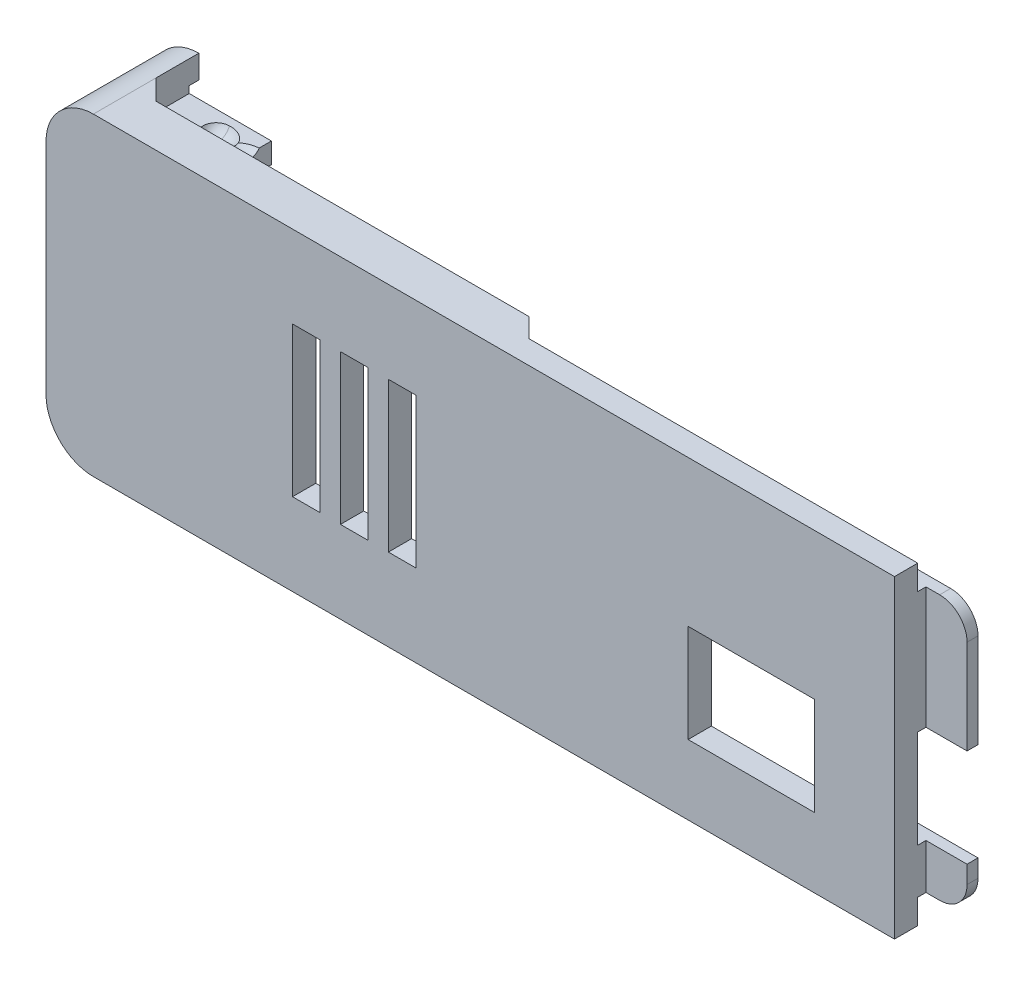
from build123d import *

# Parameters (mm, degrees)
BOSS_EXTRUDE2_DEPTH       = 7.7
BOSS_EXTRUDE3_DEPTH       = 58.493998982
BOSS_EXTRUDE4_REACH       = 69.972
SKETCH7_W                 = 6
SKETCH7_H                 = 7
BOSS_EXTRUDE5_DEPTH       = 1.9
SKETCH9_W                 = 5
SKETCH9_H                 = 0.4
CUT_EXTRUDE1_DEPTH        = 6
SKETCH10_W                = 51.633694728
SKETCH10_H                = 3.1
BOSS_EXTRUDE6_DEPTH       = 1
MIRROR1_START             = 27.403764687
MIRROR1_DEPTH             = 2.800044537
MIRROR1_START_2           = 29.203809224
MIRROR1_2_DEPTH           = 1
MIRROR1_START_3           = 30.203809224
MIRROR1_3_OUTLINE_W       = 6
MIRROR1_3_OUTLINE_H       = 7
MIRROR1_3_DEPTH           = 0.9
MIRROR1_4_OUTLINE_W       = 0.860304254
MIRROR1_4_OUTLINE_H       = 3.1
MIRROR1_4_DEPTH           = 1.800044537
MIRROR1_START_4           = 5.029168405
MIRROR1_5_OUTLINE_W       = 1
MIRROR1_5_OUTLINE_H       = 3.9
MIRROR1_5_DEPTH           = 6
BOSS_EXTRUDE7_START       = -1.7
BOSS_EXTRUDE7_DEPTH       = 1.7
BOSS_EXTRUDE12_DEPTH      = 3
BOSS_EXTRUDE12_DEPTH_BACK = 1.7
SKETCH14_W                = 1.4
SKETCH14_H                = 19.327817751
FILLET1_R                 = 2
CUT_EXTRUDE2_DEPTH        = 0.6
CUT_EXTRUDE3_DEPTH        = 1.7
SKETCH18_W                = 2
SKETCH18_H                = 2.1
BOSS_EXTRUDE13_DEPTH      = 5.3
SKETCH19_W                = 9.243692919
SKETCH19_H                = 7.158225614
CUT_EXTRUDE4_DEPTH        = 1.7
SKETCH20_W                = 4.7
SKETCH20_H                = 7.158225614
CUT_EXTRUDE5_DEPTH        = 1.4
SKETCH21_W                = 2
SKETCH21_H                = 10.927906825
CUT_EXTRUDE6_DEPTH        = 84.772901086


with BuildPart() as part:
    # Sketch1 → Boss-Extrude2 (new body)
    with BuildSketch(Plane.XY):
        with BuildLine():
            Line((1.569168405, 30.881718108), (1.569168405, 46.853718091))
            ThreePointArc((1.569168405, 46.853718091), (2.581495272, 49.306663259), (5.029168405, 50.331671512))
            Line((5.029168405, 50.331671512), (5.029168405, 48.631626975))
            ThreePointArc((5.029168405, 48.631626975), (3.783584613, 48.104573798), (3.269168405, 46.853718091))
            Line((3.269168405, 46.853718091), (3.269168405, 30.881718108))
            ThreePointArc((3.269168405, 30.881718108), (3.783584613, 29.630862401), (5.029168405, 29.103809224))
            Line((5.029168405, 29.103809224), (5.029168405, 27.403764687))
            ThreePointArc((5.029168405, 27.403764687), (2.581495272, 28.428772939), (1.569168405, 30.881718108))
        make_face()
    extrude(amount=BOSS_EXTRUDE2_DEPTH)

    # Sketch3 → Boss-Extrude3 (add)
    with BuildSketch(Plane(origin=(5.029168405, 0, 0), x_dir=(0, 0, -1), z_dir=(1, 0, 0))):
        Polygon((-7.7, 48.631626975), (-7.7, 50.331671512), (-6.1, 50.331671512), (-6.1, 48.631626975), (-6.1, 48.531626975), (-7.7, 48.531626975), align=None)
    extrude(amount=BOSS_EXTRUDE3_DEPTH)

    # Boss-Extrude4: up to this face of the body (flat: up to its plane)
    boss_extrude4_end = Plane(part.part.faces().sort_by_distance((34.276167896, 48.531626975, 6.9))[0])
    # Sketch4 → Boss-Extrude4 (add, up to the picked face)
    with BuildSketch(Plane(origin=(0, 50.331671512, 0), x_dir=(1, 0, 0), z_dir=(0, 1, 0)), mode=Mode.PRIVATE) as boss_extrude4_sk1:
        Polygon((35.231704884, -6.1), (5.029168405, -6.1), (5.029168405, -3.123421356), (6.505747049, -4.6), (33.731704884, -4.6), (35.202415562, -6.070710678), align=None)
    boss_extrude4_tool1 = split(extrude(boss_extrude4_sk1.sketch, amount=-BOSS_EXTRUDE4_REACH, mode=Mode.PRIVATE), bisect_by=boss_extrude4_end, keep=Keep.BOTH, mode=Mode.PRIVATE)
    add(boss_extrude4_tool1.solids().sort_by(Axis((19.415766, 50.331672, 5.326299), (0, -1, 0)))[0])

    # Sketch7 → Boss-Extrude5 (add)
    with BuildSketch(Plane.XZ.offset(-48.531626975)):
        with Locations((8.029168405, 4.2)):
            Rectangle(SKETCH7_W, SKETCH7_H)
    extrude(amount=BOSS_EXTRUDE5_DEPTH)

    # Sketch8 → Cut-Revolve1 (revolve, cut)
    with BuildSketch(Plane(origin=(0, 48.531626975, 0), x_dir=(1, 0, 0), z_dir=(0, 1, 0))):
        with BuildLine():
            Line((7.493162671, -2.25), (9.593162671, -2.25))
            Line((9.593162671, -2.25), (11.029168405, -2.25))
            Line((11.029168405, -2.25), (11.029168405, -3.013237094))
            add(Edge.make_bspline(
                [(11.029168405, -3.013237094), (10.455622255, -2.979221008), (9.952164105, -2.7)],
                knots=[0, 0, 0, 1, 1, 1], degree=2))
            add(Edge.make_bspline(
                [(8.543162671, -3.3), (9.366293549, -3.339525323), (9.952164105, -2.7)],
                knots=[0, 0, 0, 1, 1, 1], degree=2))
            ThreePointArc((8.543162671, -3.3), (7.800700551, -2.99246212), (7.493162671, -2.25))
        make_face()
    revolve(axis=Axis((7.493162671, 48.531626975, 2.25), (1, 0, 0)), mode=Mode.SUBTRACT)

    # Sketch9 → Cut-Extrude1 (cut)
    with BuildSketch(Plane(origin=(11.029168405, 0, 0), x_dir=(0, 0, -1), z_dir=(1, 0, 0))):
        with Locations((-3.2, 48.331626975)):
            Rectangle(SKETCH9_W, SKETCH9_H)
    extrude(amount=-CUT_EXTRUDE1_DEPTH, mode=Mode.SUBTRACT)

    # Sketch10 → Boss-Extrude6 (add)
    with BuildSketch(Plane(origin=(0, 48.531626975, 0), x_dir=(-1, 0, 0), z_dir=(0, -1, 0))):
        with Locations((-37.706320023, -6.15)):
            Rectangle(SKETCH10_W, SKETCH10_H)
    extrude(amount=BOSS_EXTRUDE6_DEPTH)

    # Mirror1: read off the stored shape, not the designer's step
    # Mirror1 outline → Mirror1 (add)
    with BuildSketch(Plane(origin=(0, 0, 0), x_dir=(1, 0, 0), z_dir=(0, 1, 0)).offset(MIRROR1_START)):
        Polygon((63.523167387, -7.7), (63.523167387, -6.1), (35.231704884, -6.1), (33.731704884, -4.6), (11.889472659, -4.6), (11.889472659, -7.7), align=None)
        Polygon((5.029168405, -7.7), (11.029168405, -7.7), (11.029168405, -4.6), (6.505747049, -4.6), (5.029168405, -3.123421356), align=None)
    extrude(amount=MIRROR1_DEPTH)

    # Mirror1 2 outline → Mirror1 2 (add)
    with BuildSketch(Plane(origin=(0, 0, 0), x_dir=(1, 0, 0), z_dir=(0, 1, 0)).offset(MIRROR1_START_2)):
        Polygon((35.231704884, -6.1), (63.523167387, -6.1), (63.523167387, -4.6), (33.731704884, -4.6), align=None)
    extrude(amount=MIRROR1_2_DEPTH)

    # Mirror1 3 outline → Mirror1 3 (add)
    with BuildSketch(Plane(origin=(0, 0, 0), x_dir=(1, 0, 0), z_dir=(0, 1, 0)).offset(MIRROR1_START_3)):
        with Locations((8.029168405, -4.2)):
            Rectangle(MIRROR1_3_OUTLINE_W, MIRROR1_3_OUTLINE_H)
    extrude(amount=MIRROR1_3_DEPTH)

    # Mirror1 4 outline → Mirror1 4 (add)
    with BuildSketch(Plane(origin=(0, 0, 0), x_dir=(1, 0, 0), z_dir=(0, 1, 0)).offset(MIRROR1_START)):
        with Locations((11.459320532, -6.15)):
            Rectangle(MIRROR1_4_OUTLINE_W, MIRROR1_4_OUTLINE_H)
    extrude(amount=MIRROR1_4_DEPTH)

    # Mirror1 5 outline → Mirror1 5 (add)
    with BuildSketch(Plane.YZ.offset(MIRROR1_START_4)):
        with Locations((29.703809224, 2.65)):
            Rectangle(MIRROR1_5_OUTLINE_W, MIRROR1_5_OUTLINE_H)
    extrude(amount=MIRROR1_5_DEPTH)

    # Mirror1 6 outline → Mirror1 6 (revolve, cut)
    with BuildSketch(Plane(origin=(0, 29.203809224, 2.25), x_dir=(0, 1, 0), z_dir=(0, 0, -1))):
        with BuildLine():
            add(Edge.make_bspline(
                [(0.45, 9.952164105), (0.729221008, 10.455622255), (0.763237094, 11.029168405)],
                knots=[0, 0, 0, 1, 1, 1], degree=2))
            Line((0.763237094, 11.029168405), (0, 11.029168505))
            Line((0, 11.029168505), (0, 7.493162671))
            ThreePointArc((0, 7.493162671), (0.74246212, 7.800700551), (1.05, 8.543162671))
            add(Edge.make_bspline(
                [(1.05, 8.543162671), (1.089525323, 9.366293549), (0.45, 9.952164105)],
                knots=[0, 0, 0, 1, 1, 1], degree=2))
        make_face()
    revolve(axis=Axis((0, 29.203809224, 2.25), (1, 0, 0)), mode=Mode.SUBTRACT)

    # Sketch12 → Boss-Extrude7 (add)
    with BuildSketch(Plane.XY.offset(7.7).offset(BOSS_EXTRUDE7_START)):
        with BuildLine():
            Line((63.523167387, 50.331671512), (5.029168405, 50.331671512))
            ThreePointArc((5.029168405, 50.331671512), (2.581495272, 49.306663259), (1.569168405, 46.853718091))
            Line((1.569168405, 46.853718091), (1.569168405, 30.881718108))
            ThreePointArc((1.569168405, 30.881718108), (2.581495272, 28.428772939), (5.029168405, 27.403764687))
            Line((5.029168405, 27.403764687), (63.523167387, 27.403764687))
            Line((63.523167387, 27.403764687), (63.523167387, 50.331671512))
        make_face()
    extrude(amount=BOSS_EXTRUDE7_DEPTH)

    # Sketch14 → Boss-Extrude12 (add, two sides: drawn at the far end of the back side and taken through both)
    with BuildSketch(Plane(origin=(63.523167387, 0, 0), x_dir=(0, 0, -1), z_dir=(1, 0, 0)).offset(-BOSS_EXTRUDE12_DEPTH_BACK)):
        with Locations((-5.3, 38.8677181)):
            Rectangle(SKETCH14_W, SKETCH14_H)
    extrude(amount=BOSS_EXTRUDE12_DEPTH + BOSS_EXTRUDE12_DEPTH_BACK)

    # Fillet1
    fillet1_edges = [part.edges().sort_by_distance(p)[0] for p in [
        (66.523167387, 48.531626975, 5.3),
        (66.523167387, 29.203809224, 5.3),
    ]]
    fillet(fillet1_edges, radius=FILLET1_R)

    # Sketch15 → Cut-Extrude2 (cut)
    with BuildSketch(Plane.XY.offset(6)):
        with BuildLine():
            Line((63.523167387, 29.203809224), (64.523167387, 29.203809224))
            ThreePointArc((64.523167387, 29.203809224), (65.937380949, 29.789595662), (66.523167387, 31.203809224))
            Line((66.523167387, 31.203809224), (66.523167387, 46.531626975))
            ThreePointArc((66.523167387, 46.531626975), (65.937380949, 47.945840537), (64.523167387, 48.531626975))
            Line((64.523167387, 48.531626975), (63.523167387, 48.531626975))
            Line((63.523167387, 48.531626975), (63.523167387, 29.203809224))
        make_face()
    extrude(amount=-CUT_EXTRUDE2_DEPTH, mode=Mode.SUBTRACT)

    # Sketch16 → Cut-Extrude3 (cut)
    with BuildSketch(Plane.ZY.offset(-1.569168405)):
        with BuildLine():
            Line((1.3, 35.692718099), (1.3, 42.042718099))
            ThreePointArc((1.3, 42.042718099), (3.125, 43.867718099), (4.95, 42.042718099))
            Line((4.95, 42.042718099), (4.95, 35.692718099))
            ThreePointArc((4.95, 35.692718099), (3.125, 33.867718099), (1.3, 35.692718099))
        make_face()
    extrude(amount=-CUT_EXTRUDE3_DEPTH, mode=Mode.SUBTRACT)

    # Sketch18 → Boss-Extrude13 (add)
    with BuildSketch(Plane(origin=(0, 0, 6), x_dir=(-1, 0, 0), z_dir=(0, 0, -1))):
        with Locations((-4.029168405, 47.681626975)):
            Rectangle(SKETCH18_W, SKETCH18_H)
        with Locations((-4.029168405, 30.053809224)):
            Rectangle(SKETCH18_W, SKETCH18_H)
    extrude(amount=BOSS_EXTRUDE13_DEPTH)

    # Sketch19 → Cut-Extrude4 (cut)
    with BuildSketch(Plane.XY.offset(7.7)):
        with Locations((53.076601752, 36.072643067)):
            Rectangle(SKETCH19_W, SKETCH19_H)
    extrude(amount=-CUT_EXTRUDE4_DEPTH, mode=Mode.SUBTRACT)

    # Sketch20 → Cut-Extrude5 (cut)
    with BuildSketch(Plane(origin=(0, 0, 4.6), x_dir=(-1, 0, 0), z_dir=(0, 0, -1))):
        with Locations((-64.173167387, 36.072643067)):
            Rectangle(SKETCH20_W, SKETCH20_H)
    extrude(amount=-CUT_EXTRUDE5_DEPTH, mode=Mode.SUBTRACT)

    # Sketch21 → Cut-Extrude6 (cut, through all)
    with BuildSketch(Plane.XY.offset(7.7)):
        with Locations((20.569168405, 38.867718099)):
            Rectangle(SKETCH21_W, SKETCH21_H)
        with Locations((24.069168405, 38.867718099)):
            Rectangle(SKETCH21_W, SKETCH21_H)
        with Locations((27.569168405, 38.867718099)):
            Rectangle(SKETCH21_W, SKETCH21_H)
    extrude(amount=-CUT_EXTRUDE6_DEPTH, mode=Mode.SUBTRACT)


solid = part.part
